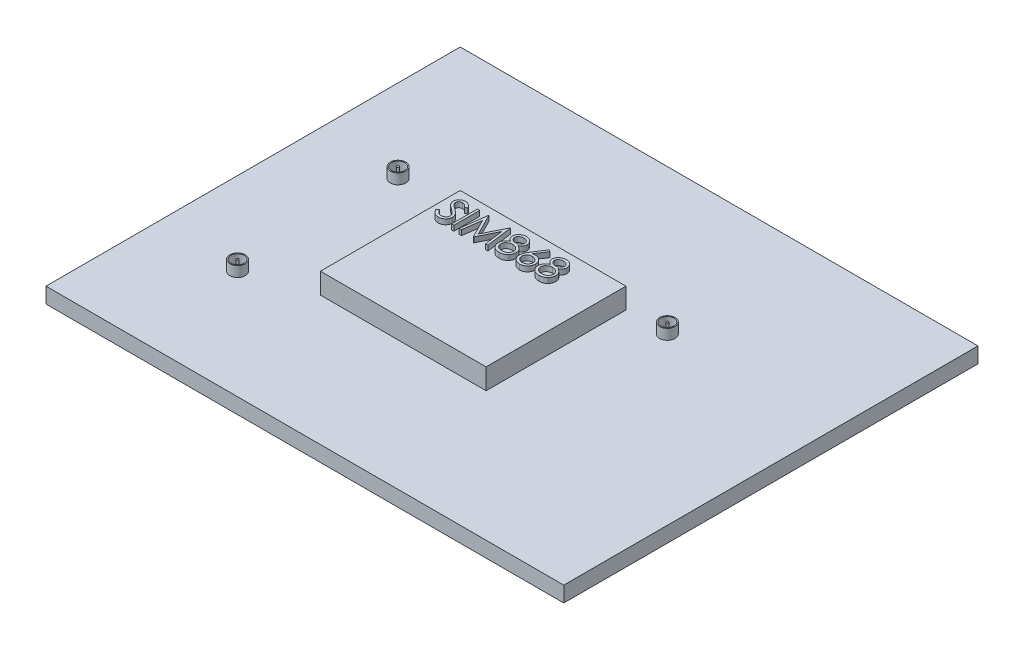
from build123d import *

# Parameters (mm, degrees)
SKETCH1_W           = 50
SKETCH1_H           = 40
BOSS_EXTRUDE1_DEPTH = 1.5
SKETCH2_W           = 16
SKETCH2_H           = 13.5
BOSS_EXTRUDE2_DEPTH = 2
SKETCH3_W           = 2.5
SKETCH3_H           = 2.5
BOSS_EXTRUDE3_DEPTH = 2
FILLET3_R           = 0.25
SKETCH4_R           = 0.25
BOSS_EXTRUDE4_DEPTH = 5.5
FILLET2_R           = 0.2
LPATTERN1_START     = -2
LPATTERN1_DEPTH     = 2
SKETCH5_W           = 0.224358974
SKETCH5_H           = 2.5
BOSS_EXTRUDE5_DEPTH = 0.5
SKETCH6_R           = 0.75
SKETCH6_R_2         = 0.65
SKETCH6_R_3         = 0.1
BOSS_EXTRUDE6_DEPTH = 1


# Read off the part's stored shape, not the designer's step: LPattern1
with BuildPart() as part:
    # Sketch1 → Boss-Extrude1 (new body)
    with BuildSketch(Plane(origin=(0, 0, 0), x_dir=(1, 0, 0), z_dir=(0, 1, 0))):
        with Locations((25, 20)):
            Rectangle(SKETCH1_W, SKETCH1_H)
    extrude(amount=BOSS_EXTRUDE1_DEPTH)

    # Sketch2 → Boss-Extrude2 (add)
    with BuildSketch(Plane(origin=(0, 1.5, 0), x_dir=(1, 0, 0), z_dir=(0, 1, 0))):
        with Locations((22, 19.25)):
            Rectangle(SKETCH2_W, SKETCH2_H)
    extrude(amount=BOSS_EXTRUDE2_DEPTH)

    # Sketch3 → Boss-Extrude3 (add)
    with BuildSketch(Plane(origin=(0, 0, 0), x_dir=(1, 0, 0), z_dir=(0, 1, 0))):
        with Locations((2.75, 26.25)):
            Rectangle(SKETCH3_W, SKETCH3_H)
    extrude(amount=-BOSS_EXTRUDE3_DEPTH)

    # Fillet3
    fillet3_edges = [part.edges().sort_by_distance(p)[0] for p in [
        (1.5, -1, -25),
        (1.5, -1, -27.5),
        (4, -1, -27.5),
        (4, -1, -25),
    ]]
    fillet(fillet3_edges, radius=FILLET3_R)

    # Sketch4 → Boss-Extrude4 (add)
    with BuildSketch(Plane(origin=(0, -2, 0), x_dir=(-1, 0, 0), z_dir=(0, -1, 0))):
        with Locations(Location((-2.75, 26.25, 0), (0, 0, 90))):
            Circle(SKETCH4_R)
    extrude(amount=BOSS_EXTRUDE4_DEPTH)

    # Fillet2
    fillet2_edges = [part.edges().sort_by_distance(p)[0] for p in [
        (2.75, -7.5, -26),
    ]]
    fillet(fillet2_edges, radius=FILLET2_R)

    # LPattern1 outline → LPattern1 (add)
    with BuildSketch(Plane(origin=(0, 0, 0), x_dir=(1, 0, 0), z_dir=(0, 1, 0)).offset(LPATTERN1_START)):
        with BuildLine():
            ThreePointArc((1.75, 25), (1.573223305, 24.926776695), (1.5, 24.75))
            Line((1.5, 24.75), (1.5, 22.75))
            ThreePointArc((1.5, 22.75), (1.573223305, 22.573223305), (1.75, 22.5))
            ThreePointArc((1.75, 22.5), (1.573223305, 22.426776695), (1.5, 22.25))
            Line((1.5, 22.25), (1.5, 20.25))
            ThreePointArc((1.5, 20.25), (1.573223305, 20.073223305), (1.75, 20))
            ThreePointArc((1.75, 20), (1.573223305, 19.926776695), (1.5, 19.75))
            Line((1.5, 19.75), (1.5, 17.75))
            ThreePointArc((1.5, 17.75), (1.573223305, 17.573223305), (1.75, 17.5))
            ThreePointArc((1.75, 17.5), (1.573223305, 17.426776695), (1.5, 17.25))
            Line((1.5, 17.25), (1.5, 15.25))
            ThreePointArc((1.5, 15.25), (1.573223305, 15.073223305), (1.75, 15))
            ThreePointArc((1.75, 15), (1.573223305, 14.926776695), (1.5, 14.75))
            Line((1.5, 14.75), (1.5, 12.75))
            ThreePointArc((1.5, 12.75), (1.573223305, 12.573223305), (1.75, 12.5))
            ThreePointArc((1.75, 12.5), (1.573223305, 12.426776695), (1.5, 12.25))
            Line((1.5, 12.25), (1.5, 10.25))
            ThreePointArc((1.5, 10.25), (1.573223305, 10.073223305), (1.75, 10))
            ThreePointArc((1.75, 10), (1.573223305, 9.926776695), (1.5, 9.75))
            Line((1.5, 9.75), (1.5, 7.75))
            ThreePointArc((1.5, 7.75), (1.573223305, 7.573223305), (1.75, 7.5))
            Line((1.75, 7.5), (3.75, 7.5))
            ThreePointArc((3.75, 7.5), (3.926776695, 7.573223305), (4, 7.75))
            Line((4, 7.75), (4, 9.75))
            ThreePointArc((4, 9.75), (3.926776695, 9.926776695), (3.75, 10))
            ThreePointArc((3.75, 10), (3.926776695, 10.073223305), (4, 10.25))
            Line((4, 10.25), (4, 12.25))
            ThreePointArc((4, 12.25), (3.926776695, 12.426776695), (3.75, 12.5))
            ThreePointArc((3.75, 12.5), (3.926776695, 12.573223305), (4, 12.75))
            Line((4, 12.75), (4, 14.75))
            ThreePointArc((4, 14.75), (3.926776695, 14.926776695), (3.75, 15))
            ThreePointArc((3.75, 15), (3.926776695, 15.073223305), (4, 15.25))
            Line((4, 15.25), (4, 17.25))
            ThreePointArc((4, 17.25), (3.926776695, 17.426776695), (3.75, 17.5))
            ThreePointArc((3.75, 17.5), (3.926776695, 17.573223305), (4, 17.75))
            Line((4, 17.75), (4, 19.75))
            ThreePointArc((4, 19.75), (3.926776695, 19.926776695), (3.75, 20))
            ThreePointArc((3.75, 20), (3.926776695, 20.073223305), (4, 20.25))
            Line((4, 20.25), (4, 22.25))
            ThreePointArc((4, 22.25), (3.926776695, 22.426776695), (3.75, 22.5))
            ThreePointArc((3.75, 22.5), (3.926776695, 22.573223305), (4, 22.75))
            Line((4, 22.75), (4, 24.75))
            ThreePointArc((4, 24.75), (3.926776695, 24.926776695), (3.75, 25))
            Line((3.75, 25), (1.75, 25))
        make_face()
    extrude(amount=LPATTERN1_DEPTH)

    # LPattern1 2 outline → LPattern1 2 (revolve)
    with BuildSketch(Plane(origin=(2.75, 0, -23.75), x_dir=(1, 0, 0), z_dir=(0, 0, 1))):
        with BuildLine():
            Line((0, -2), (0, -7.5))
            Line((0, -7.5), (0.05, -7.5))
            ThreePointArc((0.05, -7.5), (0.191421356, -7.441421356), (0.25, -7.3))
            Line((0.25, -7.3), (0.25, -2))
            Line((0.25, -2), (0, -2))
        make_face()
    revolve(axis=Axis((2.75, 0, -23.75), (0, 1, 0)))

    # LPattern1 3 outline → LPattern1 3 (revolve)
    with BuildSketch(Plane(origin=(2.75, 0, -21.25), x_dir=(1, 0, 0), z_dir=(0, 0, 1))):
        with BuildLine():
            Line((0, -2), (0, -7.5))
            Line((0, -7.5), (0.05, -7.5))
            ThreePointArc((0.05, -7.5), (0.191421356, -7.441421356), (0.25, -7.3))
            Line((0.25, -7.3), (0.25, -2))
            Line((0.25, -2), (0, -2))
        make_face()
    revolve(axis=Axis((2.75, 0, -21.25), (0, 1, 0)))

    # LPattern1 4 outline → LPattern1 4 (revolve)
    with BuildSketch(Plane(origin=(2.75, 0, -18.75), x_dir=(1, 0, 0), z_dir=(0, 0, 1))):
        with BuildLine():
            Line((0, -2), (0, -7.5))
            Line((0, -7.5), (0.05, -7.5))
            ThreePointArc((0.05, -7.5), (0.191421356, -7.441421356), (0.25, -7.3))
            Line((0.25, -7.3), (0.25, -2))
            Line((0.25, -2), (0, -2))
        make_face()
    revolve(axis=Axis((2.75, 0, -18.75), (0, 1, 0)))

    # LPattern1 5 outline → LPattern1 5 (revolve)
    with BuildSketch(Plane(origin=(2.75, 0, -16.25), x_dir=(1, 0, 0), z_dir=(0, 0, 1))):
        with BuildLine():
            Line((0, -2), (0, -7.5))
            Line((0, -7.5), (0.05, -7.5))
            ThreePointArc((0.05, -7.5), (0.191421356, -7.441421356), (0.25, -7.3))
            Line((0.25, -7.3), (0.25, -2))
            Line((0.25, -2), (0, -2))
        make_face()
    revolve(axis=Axis((2.75, 0, -16.25), (0, 1, 0)))

    # LPattern1 6 outline → LPattern1 6 (revolve)
    with BuildSketch(Plane(origin=(2.75, 0, -13.75), x_dir=(1, 0, 0), z_dir=(0, 0, 1))):
        with BuildLine():
            Line((0, -2), (0, -7.5))
            Line((0, -7.5), (0.05, -7.5))
            ThreePointArc((0.05, -7.5), (0.191421356, -7.441421356), (0.25, -7.3))
            Line((0.25, -7.3), (0.25, -2))
            Line((0.25, -2), (0, -2))
        make_face()
    revolve(axis=Axis((2.75, 0, -13.75), (0, 1, 0)))

    # LPattern1 7 outline → LPattern1 7 (revolve)
    with BuildSketch(Plane(origin=(2.75, 0, -11.25), x_dir=(1, 0, 0), z_dir=(0, 0, 1))):
        with BuildLine():
            Line((0, -2), (0, -7.5))
            Line((0, -7.5), (0.05, -7.5))
            ThreePointArc((0.05, -7.5), (0.191421356, -7.441421356), (0.25, -7.3))
            Line((0.25, -7.3), (0.25, -2))
            Line((0.25, -2), (0, -2))
        make_face()
    revolve(axis=Axis((2.75, 0, -11.25), (0, 1, 0)))

    # LPattern1 8 outline → LPattern1 8 (revolve)
    with BuildSketch(Plane(origin=(2.75, 0, -8.75), x_dir=(1, 0, 0), z_dir=(0, 0, 1))):
        with BuildLine():
            Line((0, -2), (0, -7.5))
            Line((0, -7.5), (0.05, -7.5))
            ThreePointArc((0.05, -7.5), (0.191421356, -7.441421356), (0.25, -7.3))
            Line((0.25, -7.3), (0.25, -2))
            Line((0.25, -2), (0, -2))
        make_face()
    revolve(axis=Axis((2.75, 0, -8.75), (0, 1, 0)))

    # Sketch5 → Boss-Extrude5 (add)
    # profile 1 of 6: a face of its own
    with BuildSketch(Plane(origin=(0, 3.5, 0), x_dir=(1, 0, 0), z_dir=(0, 1, 0))):
        with BuildLine():
            Line((14.892330451, 22.763294846), (15.103668592, 22.889997571))
            add(Edge.make_bspline(
                [(15.103668592, 22.889997571), (15.123324476, 22.857094439), (15.160984391, 22.794053307), (15.22380679, 22.708868993), (15.288901727, 22.636467452), (15.356751251, 22.577269875), (15.426941214, 22.530663528), (15.499929824, 22.497661934), (15.575471117, 22.477079094), (15.626880989, 22.474579032), (15.652546798, 22.473330904)],
                knots=[0, 0, 0, 0, 1.272034388, 2.437168799, 3.508375237, 4.49857839, 5.41946034, 6.295179144, 7.148887113, 8, 8, 8, 8], degree=3))
            add(Edge.make_bspline(
                [(15.652546798, 22.473330904), (15.674465984, 22.473941384), (15.717920821, 22.475151663), (15.781893852, 22.486780807), (15.844023711, 22.504646614), (15.903029881, 22.530232993), (15.958098177, 22.561189055), (16.006388673, 22.598579182), (16.048135897, 22.640440757), (16.082285265, 22.687142653), (16.10848529, 22.737369188), (16.128622482, 22.788923439), (16.139797534, 22.842615273), (16.14148093, 22.878765604), (16.142330451, 22.897008789)],
                knots=[0, 0, 0, 0, 1.095163259, 2.171163733, 3.241058638, 4.321873601, 5.38011039, 6.391990106, 7.366004449, 8.327778327, 9.272591725, 10.192022065, 11.087607919, 12, 12, 12, 12], degree=3))
            add(Edge.make_bspline(
                [(16.142330451, 22.897008789), (16.141277372, 22.917823681), (16.139136616, 22.960137316), (16.121042702, 23.02256564), (16.092578954, 23.084346047), (16.066319923, 23.122561237), (16.052687022, 23.142401417)],
                knots=[0, 0, 0, 0, 0.938893495, 1.908633276, 2.914225137, 4, 4, 4, 4], degree=3))
            add(Edge.make_bspline(
                [(16.052687022, 23.142401417), (16.041493726, 23.156720577), (16.017994802, 23.186781861), (15.977596578, 23.231528458), (15.930192211, 23.277684472), (15.877403957, 23.327012369), (15.817308894, 23.377217938), (15.751789241, 23.43069528), (15.679172199, 23.485410692), (15.628243987, 23.522105382), (15.601965868, 23.541039237)],
                knots=[0, 0, 0, 0, 0.722233717, 1.516239348, 2.393582979, 3.351407094, 4.387010283, 5.505090956, 6.712668013, 8, 8, 8, 8], degree=3))
            add(Edge.make_bspline(
                [(15.601965868, 23.541039237), (15.575663014, 23.559773943), (15.525373959, 23.595593273), (15.4550464, 23.648753476), (15.392157498, 23.69735624), (15.336986772, 23.741859106), (15.289558488, 23.782268109), (15.249498909, 23.818195208), (15.217828511, 23.850612038), (15.200217382, 23.871641567), (15.192310419, 23.881083308)],
                knots=[0, 0, 0, 0, 1.452282411, 2.77665338, 3.964542531, 5.026858415, 5.96415736, 6.766646006, 7.446254459, 8, 8, 8, 8], degree=3))
            add(Edge.make_bspline(
                [(15.192310419, 23.881083308), (15.181258601, 23.895798334), (15.159523718, 23.924737408), (15.130833714, 23.96996945), (15.106448598, 24.016271782), (15.087332646, 24.063768828), (15.071235347, 24.111793777), (15.060408254, 24.160973239), (15.053628684, 24.211086537), (15.052934408, 24.244810466), (15.052586862, 24.261692282)],
                knots=[0, 0, 0, 0, 1.068054152, 2.10047183, 3.106115577, 4.101338837, 5.06977816, 6.043150881, 7.020423561, 8, 8, 8, 8], degree=3))
            add(Edge.make_bspline(
                [(15.052586862, 24.261692282), (15.053519154, 24.288142121), (15.055363811, 24.340476452), (15.07096418, 24.416927046), (15.095587676, 24.489917344), (15.130084024, 24.558724725), (15.174553562, 24.621557568), (15.226014972, 24.67913863), (15.287308891, 24.727544761), (15.354560765, 24.769839088), (15.428172459, 24.80294332), (15.505308819, 24.827915449), (15.586092442, 24.842064919), (15.640808966, 24.844095465), (15.668572439, 24.845125776)],
                knots=[0, 0, 0, 0, 1.005424448, 1.989358655, 2.955360095, 3.929531133, 4.905563448, 5.876582895, 6.856512386, 7.866279853, 8.892233794, 9.918561126, 10.94386622, 12, 12, 12, 12], degree=3))
            add(Edge.make_bspline(
                [(15.668572439, 24.845125776), (15.69803251, 24.844109668), (15.75661919, 24.842088952), (15.842797201, 24.824519287), (15.925769141, 24.795447379), (15.992514331, 24.76245548), (16.044752017, 24.729504469), (16.084589684, 24.699490309), (16.124959291, 24.66493666), (16.166186473, 24.625751484), (16.207572659, 24.581575233), (16.249732267, 24.532710455), (16.292763888, 24.479455773), (16.320446645, 24.441438272), (16.334638144, 24.421948692)],
                knots=[0, 0, 0, 0, 1.286793592, 2.559021753, 3.825965368, 5.121522368, 5.803751409, 6.523245864, 7.299691795, 8.125521123, 9.008227632, 9.944561021, 10.946284179, 12, 12, 12, 12], degree=3))
            Line((16.334638144, 24.421948692), (16.131813624, 24.268202699))
            add(Edge.make_bspline(
                [(16.131813624, 24.268202699), (16.11956653, 24.283980335), (16.095981489, 24.314364373), (16.060174713, 24.356915313), (16.026425678, 24.395784227), (15.993175393, 24.429545032), (15.962179942, 24.460046556), (15.93209634, 24.486160668), (15.903357518, 24.508143236), (15.867131153, 24.531602922), (15.821618497, 24.554857567), (15.764486686, 24.57453548), (15.704782204, 24.586360525), (15.664118181, 24.587924016), (15.643532374, 24.588715519)],
                knots=[0, 0, 0, 0, 1.181633172, 2.275549214, 3.290209073, 4.226197932, 5.078386478, 5.862611352, 6.581680152, 7.217281963, 8.414376989, 9.595101626, 10.782541182, 12, 12, 12, 12], degree=3))
            add(Edge.make_bspline(
                [(15.643532374, 24.588715519), (15.617706287, 24.587850019), (15.56790311, 24.586180984), (15.497195799, 24.567952423), (15.433557281, 24.539251095), (15.378876877, 24.49902611), (15.333350465, 24.451368258), (15.300417995, 24.396526219), (15.280596448, 24.33596736), (15.278177677, 24.29372332), (15.276945836, 24.272209109)],
                knots=[0, 0, 0, 0, 1.14458467, 2.207223713, 3.21896685, 4.227309161, 5.202851033, 6.127160689, 7.046193047, 8, 8, 8, 8], degree=3))
            add(Edge.make_bspline(
                [(15.276945836, 24.272209109), (15.277226641, 24.258815196), (15.277788709, 24.232005468), (15.285627851, 24.192397309), (15.2956988, 24.15288921), (15.311657823, 24.113658793), (15.333690182, 24.074019965), (15.362622451, 24.033290153), (15.399060531, 23.991110361), (15.426972682, 23.963676523), (15.441709458, 23.949192282)],
                knots=[0, 0, 0, 0, 0.858281714, 1.717966888, 2.583508476, 3.4729293, 4.427298488, 5.488583878, 6.674047936, 8, 8, 8, 8], degree=3))
            add(Edge.make_bspline(
                [(15.441709458, 23.949192282), (15.447181867, 23.944308692), (15.460183057, 23.932706401), (15.483951576, 23.913711915), (15.515339289, 23.890281363), (15.553526575, 23.861290423), (15.599217548, 23.827660807), (15.652417231, 23.789822512), (15.712532612, 23.746547184), (15.755191123, 23.716291798), (15.777747118, 23.700294045)],
                knots=[0, 0, 0, 0, 0.420754252, 0.999615792, 1.744751191, 2.668019286, 3.750313428, 4.999500688, 6.413464383, 8, 8, 8, 8], degree=3))
            add(Edge.make_bspline(
                [(15.777747118, 23.700294045), (15.804879913, 23.680550217), (15.857418811, 23.64231903), (15.932174225, 23.584879258), (15.999955516, 23.528702281), (16.061000662, 23.474146847), (16.115912739, 23.421626781), (16.16408254, 23.370510223), (16.206000883, 23.321163386), (16.251128896, 23.25789726), (16.297241624, 23.180196486), (16.336842701, 23.084997744), (16.361812949, 22.989428944), (16.365078317, 22.925195489), (16.366689426, 22.89350318)],
                knots=[0, 0, 0, 0, 1.163667725, 2.253281268, 3.268753668, 4.215851969, 5.092017293, 5.902905408, 6.650798638, 7.335211899, 8.59617414, 9.77448103, 10.901945474, 12, 12, 12, 12], degree=3))
            add(Edge.make_bspline(
                [(16.366689426, 22.89350318), (16.366220041, 22.871090062), (16.365290388, 22.826699074), (16.354604021, 22.761516876), (16.338947117, 22.698209112), (16.315349093, 22.637558317), (16.286546837, 22.578454915), (16.249999517, 22.522449272), (16.207636885, 22.468301844), (16.159041339, 22.417456493), (16.105865694, 22.370780639), (16.049663055, 22.329259881), (15.990341432, 22.29463965), (15.928222634, 22.266389049), (15.863292393, 22.244293679), (15.795572548, 22.228284487), (15.724951468, 22.218458979), (15.676951124, 22.217439149), (15.652546798, 22.216920648)],
                knots=[0, 0, 0, 0, 0.983748083, 1.948392443, 2.894712957, 3.844097841, 4.80183111, 5.778335162, 6.776009319, 7.81870978, 8.863265674, 9.881300176, 10.883814829, 11.87499822, 12.874611388, 13.892143829, 14.928324115, 16, 16, 16, 16], degree=3))
            add(Edge.make_bspline(
                [(15.652546798, 22.216920648), (15.63366441, 22.217285777), (15.596137438, 22.218011438), (15.540630665, 22.224426639), (15.486245245, 22.233503141), (15.433663615, 22.247913191), (15.382208321, 22.265396746), (15.332103153, 22.286924127), (15.283323829, 22.312722128), (15.235596984, 22.342218574), (15.189044002, 22.376545534), (15.144101525, 22.416526603), (15.099294964, 22.461059107), (15.055946824, 22.511352366), (15.013180292, 22.566593854), (14.971838571, 22.627300414), (14.931065915, 22.693141381), (14.905483438, 22.739473585), (14.892330451, 22.763294846)],
                knots=[0, 0, 0, 0, 0.915332311, 1.819136955, 2.706846663, 3.586547465, 4.459518054, 5.340707479, 6.227863349, 7.133153174, 8.059268498, 9.028702269, 10.047606654, 11.120612155, 12.245963614, 13.433783089, 14.680604001, 16, 16, 16, 16], degree=3))
        make_face()
    # profile 2 of 6: a face of its own
    with BuildSketch(Plane(origin=(0, 3.5, 0), x_dir=(1, 0, 0), z_dir=(0, 1, 0))):
        with Locations((16.991689426, 23.531023212)):
            Rectangle(SKETCH5_W, SKETCH5_H)
    # profile 3 of 6: a face of its own
    with BuildSketch(Plane(origin=(0, 3.5, 0), x_dir=(1, 0, 0), z_dir=(0, 1, 0))):
        Polygon((17.616689426, 22.281023212), (17.946717471, 24.781023212), (17.978768753, 24.781023212), (19.010920195, 22.72974116), (20.040567631, 24.781023212), (20.073119714, 24.781023212), (20.405150964, 22.281023212), (20.179790387, 22.281023212), (19.940407374, 24.079901417), (19.037963464, 22.281023212), (18.987382535, 22.281023212), (18.081433015, 24.083907827), (17.842550804, 22.281023212), align=None)
    # profile 4 of 6: a face of its own
    with BuildSketch(Plane(origin=(0, 3.5, 0), x_dir=(1, 0, 0), z_dir=(0, 1, 0))):
        with BuildLine():
            add(Edge.make_bspline(
                [(21.909057214, 23.673751577), (21.929520462, 23.663081609), (21.96943063, 23.642271606), (22.026271493, 23.608763872), (22.078217922, 23.573448898), (22.126711181, 23.537994712), (22.170899288, 23.501043533), (22.210288155, 23.462448421), (22.24585074, 23.423172746), (22.276869872, 23.382551431), (22.304153327, 23.340692396), (22.327733423, 23.297485773), (22.347888568, 23.253026249), (22.363862096, 23.206828513), (22.377020518, 23.159571183), (22.386074522, 23.110644053), (22.390943749, 23.060369524), (22.39186433, 23.026392166), (22.392330451, 23.009188276)],
                knots=[0, 0, 0, 0, 1.272397273, 2.481599622, 3.635517121, 4.734568067, 5.792894095, 6.808321871, 7.773003508, 8.711915296, 9.623354172, 10.525449501, 11.423591555, 12.311487226, 13.218079475, 14.126165749, 15.051214107, 16, 16, 16, 16], degree=3))
            add(Edge.make_bspline(
                [(22.392330451, 23.009188276), (22.391779437, 22.985118467), (22.390688772, 22.937475283), (22.381188783, 22.867156632), (22.366965227, 22.798862502), (22.346194147, 22.732607866), (22.319256011, 22.668758314), (22.286058271, 22.60725919), (22.248478838, 22.54710254), (22.218298668, 22.510088682), (22.203027567, 22.49135975)],
                knots=[0, 0, 0, 0, 1.025265484, 2.029385089, 3.018602448, 3.995076438, 4.983346944, 5.966715145, 6.97116228, 8, 8, 8, 8], degree=3))
            add(Edge.make_bspline(
                [(22.203027567, 22.49135975), (22.183144371, 22.469507054), (22.143623681, 22.426071702), (22.07592159, 22.369678267), (22.001620244, 22.322285842), (21.92100715, 22.283663061), (21.834297791, 22.253601733), (21.741510645, 22.231999934), (21.642464822, 22.219626771), (21.574389485, 22.217838206), (21.539465868, 22.216920648)],
                knots=[0, 0, 0, 0, 0.954267603, 1.896743057, 2.838368354, 3.796610408, 4.779680527, 5.799409237, 6.871065594, 8, 8, 8, 8], degree=3))
            add(Edge.make_bspline(
                [(21.539465868, 22.216920648), (21.505884876, 22.217743846), (21.440539677, 22.219345707), (21.345426907, 22.230198872), (21.256767572, 22.249218777), (21.174046166, 22.275250641), (21.097761385, 22.30911509), (21.028130598, 22.351263953), (20.964149189, 22.400000697), (20.907758851, 22.456725039), (20.857695677, 22.517480662), (20.813718496, 22.580160383), (20.777165583, 22.644769924), (20.746217658, 22.710345901), (20.722526213, 22.77780744), (20.706117491, 22.846807449), (20.695696553, 22.917225408), (20.694310028, 22.964748018), (20.693612503, 22.988655423)],
                knots=[0, 0, 0, 0, 1.256902934, 2.445805442, 3.576955095, 4.645999104, 5.686449165, 6.692658513, 7.68621702, 8.689161843, 9.678783111, 10.630372946, 11.551080876, 12.453998257, 13.34127905, 14.221779781, 15.105423033, 16, 16, 16, 16], degree=3))
            add(Edge.make_bspline(
                [(20.693612503, 22.988655423), (20.694025275, 23.006197703), (20.694841058, 23.04086744), (20.700487378, 23.092088389), (20.709564851, 23.141942771), (20.721893034, 23.190614731), (20.73860091, 23.237749926), (20.758773863, 23.283571692), (20.782296686, 23.328131763), (20.809497518, 23.371673821), (20.841141821, 23.413587758), (20.876972999, 23.454584897), (20.917707191, 23.494029088), (20.962891233, 23.532402249), (21.012008761, 23.570385087), (21.066335569, 23.605924893), (21.124431474, 23.641537725), (21.16572105, 23.662829386), (21.186901765, 23.673751577)],
                knots=[0, 0, 0, 0, 0.941657376, 1.861047343, 2.762797495, 3.66048619, 4.553285746, 5.444104102, 6.34607688, 7.256116206, 8.197091036, 9.162375105, 10.176350973, 11.237807142, 12.343728897, 13.50695164, 14.721116704, 16, 16, 16, 16], degree=3))
            add(Edge.make_bspline(
                [(21.186901765, 23.673751577), (21.157907926, 23.689562126), (21.101767739, 23.720175774), (21.027432424, 23.776423493), (20.963581978, 23.837343361), (20.911971466, 23.904221786), (20.871348446, 23.974969553), (20.843478014, 24.049144019), (20.824623382, 24.125369814), (20.822755649, 24.177445669), (20.821817631, 24.203599334)],
                knots=[0, 0, 0, 0, 1.166880483, 2.259407225, 3.286803203, 4.280235371, 5.237608625, 6.161067461, 7.076446754, 8, 8, 8, 8], degree=3))
            add(Edge.make_bspline(
                [(20.821817631, 24.203599334), (20.822985791, 24.230240447), (20.825333996, 24.28379373), (20.844322083, 24.36351239), (20.875264987, 24.441809936), (20.917351414, 24.518306874), (20.969770854, 24.59041417), (21.032661244, 24.655086275), (21.104520741, 24.711737333), (21.184990646, 24.759291743), (21.271587958, 24.797994356), (21.362956332, 24.824693229), (21.457503827, 24.842147598), (21.521859341, 24.84412378), (21.554489906, 24.845125776)],
                knots=[0, 0, 0, 0, 0.888701115, 1.786444228, 2.72001202, 3.692817113, 4.693886446, 5.687152267, 6.695133018, 7.739871481, 8.800368666, 9.853104506, 10.91144658, 12, 12, 12, 12], degree=3))
            add(Edge.make_bspline(
                [(21.554489906, 24.845125776), (21.586278346, 24.844092674), (21.648961527, 24.842055514), (21.741100546, 24.825064887), (21.829261173, 24.796686658), (21.913139387, 24.758188641), (21.991233578, 24.710769398), (22.060235227, 24.653340202), (22.121187071, 24.58895338), (22.171604496, 24.516867949), (22.213149417, 24.440664954), (22.242078632, 24.360934582), (22.260615756, 24.27939954), (22.262953873, 24.224229537), (22.264125323, 24.196588116)],
                knots=[0, 0, 0, 0, 1.072916533, 2.115669174, 3.151510826, 4.193348718, 5.225979165, 6.227137561, 7.216255879, 8.211077061, 9.189680878, 10.138522389, 11.067357538, 12, 12, 12, 12], degree=3))
            add(Edge.make_bspline(
                [(22.264125323, 24.196588116), (22.263100637, 24.169461927), (22.261088212, 24.116187635), (22.244159683, 24.038525834), (22.215650174, 23.965795807), (22.176725772, 23.897172269), (22.12599328, 23.833899771), (22.0641299, 23.775173721), (21.991628844, 23.720511701), (21.937156782, 23.689664298), (21.909057214, 23.673751577)],
                knots=[0, 0, 0, 0, 0.975232327, 1.915300861, 2.843280834, 3.77672583, 4.742871857, 5.749627742, 6.839139064, 8, 8, 8, 8], degree=3))
        make_face()
        with BuildLine():
            add(Edge.make_bspline(
                [(21.541969874, 24.588715519), (21.524433585, 24.588250205), (21.490124934, 24.587339846), (21.43981874, 24.582583676), (21.391981335, 24.573331379), (21.346112906, 24.561018013), (21.302842326, 24.544383736), (21.26158193, 24.524815872), (21.223033937, 24.501025826), (21.186733006, 24.474339256), (21.154053881, 24.44498718), (21.12505063, 24.414405952), (21.10095912, 24.381994958), (21.080501185, 24.348560415), (21.065657244, 24.313110004), (21.054539884, 24.276730592), (21.047024604, 24.23896246), (21.046461468, 24.213150667), (21.046176605, 24.200093725)],
                knots=[0, 0, 0, 0, 1.203892937, 2.355340988, 3.463153438, 4.544400666, 5.610487187, 6.640501085, 7.674077295, 8.714426146, 9.728707835, 10.68524104, 11.601827946, 12.495867327, 13.368432065, 14.231010473, 15.105153427, 16, 16, 16, 16], degree=3))
            add(Edge.make_bspline(
                [(21.046176605, 24.200093725), (21.046667582, 24.187036218), (21.047637821, 24.161232708), (21.055141484, 24.123128518), (21.066324952, 24.085684492), (21.083932567, 24.049790984), (21.105051395, 24.014202871), (21.131116735, 23.979809595), (21.162180326, 23.946491463), (21.197199926, 23.914531862), (21.235351025, 23.884604174), (21.275768198, 23.85862333), (21.317944192, 23.83688468), (21.36144567, 23.818792248), (21.40671599, 23.804728007), (21.453477757, 23.794750402), (21.50173883, 23.788548976), (21.534439245, 23.787808247), (21.550984298, 23.787433468)],
                knots=[0, 0, 0, 0, 0.873023192, 1.725219244, 2.590779336, 3.480155217, 4.391973325, 5.357036234, 6.360879153, 7.436073238, 8.526419356, 9.601555421, 10.645666583, 11.697338044, 12.750135903, 13.812665442, 14.89329948, 16, 16, 16, 16], degree=3))
            add(Edge.make_bspline(
                [(21.550984298, 23.787433468), (21.572234372, 23.788056945), (21.614524634, 23.78929774), (21.676867014, 23.800834292), (21.737483189, 23.818981376), (21.795725263, 23.843809924), (21.850085681, 23.874972681), (21.898542873, 23.912281979), (21.94068351, 23.954876335), (21.976069661, 24.002092646), (22.003505265, 24.05234378), (22.024863699, 24.102772561), (22.037335996, 24.153917012), (22.03896283, 24.188179129), (22.039766349, 24.205101737)],
                knots=[0, 0, 0, 0, 1.076279235, 2.141928126, 3.20205304, 4.278698113, 5.344010996, 6.36967002, 7.368914609, 8.37248503, 9.349703398, 10.264243087, 11.142681841, 12, 12, 12, 12], degree=3))
            add(Edge.make_bspline(
                [(22.039766349, 24.205101737), (22.039386422, 24.216978906), (22.038632322, 24.240553383), (22.032417996, 24.275366501), (22.022149544, 24.309387632), (22.008247344, 24.342897826), (21.989954633, 24.37542692), (21.968265928, 24.407486268), (21.941919855, 24.438354671), (21.912350974, 24.468751492), (21.87881854, 24.496882937), (21.841387174, 24.521622016), (21.800248781, 24.542630842), (21.755402388, 24.559694238), (21.707013156, 24.572510202), (21.65530396, 24.582107593), (21.599843641, 24.587516959), (21.561679533, 24.588307334), (21.541969874, 24.588715519)],
                knots=[0, 0, 0, 0, 0.814439003, 1.616544685, 2.417341072, 3.248991801, 4.09997495, 4.973547432, 5.9003056, 6.880240646, 7.880314356, 8.896779544, 9.951930927, 11.043077905, 12.18215768, 13.381699519, 14.647792085, 16, 16, 16, 16], degree=3))
        make_face(mode=Mode.SUBTRACT)
        with BuildLine():
            add(Edge.make_bspline(
                [(21.556493112, 23.531023212), (21.534260408, 23.530627754), (21.490645267, 23.529851961), (21.426747461, 23.521216604), (21.365423772, 23.509195609), (21.30688096, 23.490959296), (21.251143748, 23.467247517), (21.197910403, 23.438722845), (21.147588168, 23.405004672), (21.100871935, 23.366521375), (21.058212414, 23.325050336), (21.020785057, 23.281148811), (20.989001114, 23.235632716), (20.963405934, 23.187923981), (20.942397554, 23.139032831), (20.928601928, 23.087741691), (20.919757848, 23.03503661), (20.918570254, 22.999207969), (20.917971477, 22.981143404)],
                knots=[0, 0, 0, 0, 1.140299081, 2.23698856, 3.303958914, 4.344563908, 5.37730929, 6.408454204, 7.439741482, 8.480804886, 9.510774543, 10.48932336, 11.43758569, 12.353841022, 13.263987381, 14.161954604, 15.073269652, 16, 16, 16, 16], degree=3))
            add(Edge.make_bspline(
                [(20.917971477, 22.981143404), (20.918945233, 22.958692757), (20.920877143, 22.914151197), (20.936203314, 22.848320432), (20.960800125, 22.784591107), (20.99510385, 22.72348257), (21.037580688, 22.666375351), (21.089813879, 22.616597654), (21.148557335, 22.572368026), (21.215798659, 22.536596217), (21.289247563, 22.508028463), (21.368884513, 22.488345633), (21.453566597, 22.475316026), (21.512037735, 22.474003039), (21.541969874, 22.473330904)],
                knots=[0, 0, 0, 0, 0.898778495, 1.783155532, 2.693654817, 3.627872908, 4.583023416, 5.533784346, 6.509005473, 7.520592997, 8.575161974, 9.658835044, 10.801527049, 12, 12, 12, 12], degree=3))
            add(Edge.make_bspline(
                [(21.541969874, 22.473330904), (21.565362994, 22.473780053), (21.610940294, 22.474655139), (21.677430257, 22.482379635), (21.740176363, 22.494629367), (21.799056934, 22.512446185), (21.854731105, 22.534196168), (21.906254929, 22.562176227), (21.954953877, 22.593999315), (21.99842825, 22.631755141), (22.0380234, 22.672097637), (22.07254718, 22.714804811), (22.102516859, 22.758715977), (22.126038971, 22.804823466), (22.144843438, 22.85224269), (22.158360262, 22.901410913), (22.166700416, 22.952478936), (22.167543913, 22.98712113), (22.167971477, 23.004681064)],
                knots=[0, 0, 0, 0, 1.224942928, 2.386581632, 3.501229538, 4.569074225, 5.605009692, 6.626002462, 7.634866581, 8.645888296, 9.63523824, 10.59253846, 11.518950513, 12.414518923, 13.29783783, 14.186679152, 15.080837789, 16, 16, 16, 16], degree=3))
            add(Edge.make_bspline(
                [(22.167971477, 23.004681064), (22.167324442, 23.021736308), (22.166048603, 23.055366268), (22.157950966, 23.105199501), (22.14372534, 23.153344369), (22.124205771, 23.200380087), (22.098219369, 23.245353623), (22.06761589, 23.289436603), (22.03069152, 23.331405492), (21.988968237, 23.371586275), (21.94349755, 23.408740372), (21.895163876, 23.441607829), (21.84433926, 23.469287912), (21.791131252, 23.491799694), (21.735657998, 23.50950503), (21.677960299, 23.521873597), (21.617970603, 23.529659028), (21.577217123, 23.530563347), (21.556493112, 23.531023212)],
                knots=[0, 0, 0, 0, 0.917430815, 1.809013306, 2.70690318, 3.612392954, 4.541220862, 5.495268465, 6.494511384, 7.542276156, 8.608045339, 9.649016899, 10.681629292, 11.715607085, 12.752076957, 13.808767841, 14.885711793, 16, 16, 16, 16], degree=3))
        make_face(mode=Mode.SUBTRACT)
    # profile 5 of 6: a face of its own
    with BuildSketch(Plane(origin=(0, 3.5, 0), x_dir=(1, 0, 0), z_dir=(0, 1, 0))):
        with BuildLine():
            Line((23.77053558, 24.845125776), (23.943312022, 24.709408628))
            Line((23.943312022, 24.709408628), (23.282755131, 23.699292442))
            add(Edge.make_bspline(
                [(23.282755131, 23.699292442), (23.3267339, 23.706302343), (23.412519462, 23.719975946), (23.499352247, 23.722231622), (23.541669394, 23.723330904)],
                knots=[0, 0, 0, 0, 1.025318673, 2, 2, 2, 2], degree=3))
            add(Edge.make_bspline(
                [(23.541669394, 23.723330904), (23.56707832, 23.722647967), (23.617095034, 23.721303626), (23.690528464, 23.710958018), (23.76109199, 23.694654367), (23.828493142, 23.67088847), (23.892973843, 23.640529645), (23.954904126, 23.604144738), (24.013119847, 23.559854966), (24.06837069, 23.510379998), (24.118532902, 23.455582152), (24.16294437, 23.39743834), (24.200249222, 23.336009139), (24.230516309, 23.271325664), (24.254019793, 23.203487621), (24.271153825, 23.132581807), (24.281282106, 23.058559328), (24.282657456, 23.008217774), (24.283356092, 22.982645808)],
                knots=[0, 0, 0, 0, 1.04369286, 2.054478336, 3.041073146, 4.015093852, 4.984733326, 5.965804835, 6.960378782, 7.985147595, 9.009457201, 10.008161701, 10.986880575, 11.956520048, 12.937015923, 13.931873656, 14.949455224, 16, 16, 16, 16], degree=3))
            add(Edge.make_bspline(
                [(24.283356092, 22.982645808), (24.282339589, 22.947660305), (24.280339351, 22.878817115), (24.260408068, 22.778548039), (24.229436893, 22.683024814), (24.18516723, 22.593772548), (24.130179813, 22.51091357), (24.06312439, 22.437495381), (23.986379041, 22.372016783), (23.899602757, 22.317262054), (23.806214925, 22.272545589), (23.708106356, 22.240427559), (23.606229823, 22.220653653), (23.537083674, 22.218174651), (23.502106092, 22.216920648)],
                knots=[0, 0, 0, 0, 1.031375318, 2.029502543, 3.004789286, 3.987476834, 4.960371455, 5.9300674, 6.912260825, 7.929083631, 8.949397511, 9.960523116, 10.96833055, 12, 12, 12, 12], degree=3))
            add(Edge.make_bspline(
                [(23.502106092, 22.216920648), (23.468465592, 22.218012223), (23.40182965, 22.220174443), (23.303806226, 22.239435827), (23.209618356, 22.270655186), (23.119925942, 22.313665385), (23.036839789, 22.367992445), (22.962507192, 22.433394073), (22.897298782, 22.508472262), (22.843031195, 22.593215367), (22.799989244, 22.684279623), (22.767710726, 22.779234734), (22.748856266, 22.877734721), (22.746221583, 22.944506963), (22.744894554, 22.978138596)],
                knots=[0, 0, 0, 0, 1.012016664, 2.004627821, 2.994792927, 3.992885782, 4.990978636, 5.973936114, 6.964471063, 7.975201453, 8.993600317, 9.990122807, 10.98767138, 12, 12, 12, 12], degree=3))
            add(Edge.make_bspline(
                [(22.744894554, 22.978138596), (22.745738443, 23.003884727), (22.747461504, 23.056453407), (22.759492497, 23.13607057), (22.778824493, 23.217535628), (22.800474669, 23.286645767), (22.823350105, 23.34326114), (22.842387633, 23.38890649), (22.866083345, 23.435878685), (22.891350046, 23.485788425), (22.920462095, 23.537349448), (22.95211613, 23.591423498), (22.987187309, 23.647150589), (23.01177314, 23.684967872), (23.024341669, 23.704300455)],
                knots=[0, 0, 0, 0, 1.173818275, 2.396712641, 3.66331629, 4.989737886, 5.693666774, 6.447286557, 7.243889047, 8.091586357, 8.998013824, 9.943181721, 10.948533338, 12, 12, 12, 12], degree=3))
            Line((23.024341669, 23.704300455), (23.77053558, 24.845125776))
        make_face()
        with BuildLine():
            add(Edge.make_bspline(
                [(23.494594073, 23.466920648), (23.475549613, 23.466364902), (23.438350249, 23.46527937), (23.383773524, 23.458975618), (23.332121201, 23.447104857), (23.282708963, 23.431986049), (23.236460604, 23.411198149), (23.193040004, 23.385946864), (23.152279253, 23.356217451), (23.114605287, 23.322431086), (23.080448385, 23.285439634), (23.051033291, 23.245818547), (23.025660148, 23.204522687), (23.005030278, 23.161207014), (22.988965938, 23.115888086), (22.977345759, 23.068774336), (22.970878794, 23.019549832), (22.969802914, 22.986169473), (22.969253528, 22.969124173)],
                knots=[0, 0, 0, 0, 1.129588631, 2.206414736, 3.251139165, 4.268635594, 5.265702196, 6.250456724, 7.242448911, 8.251968645, 9.246821453, 10.222880186, 11.173611482, 12.116736599, 13.062300278, 14.020270554, 14.989073742, 16, 16, 16, 16], degree=3))
            add(Edge.make_bspline(
                [(22.969253528, 22.969124173), (22.969700929, 22.95223133), (22.970578216, 22.919106981), (22.978544159, 22.870293281), (22.990712075, 22.823318346), (23.008812358, 22.778424347), (23.030402992, 22.734926977), (23.058906795, 22.694401773), (23.090490214, 22.654387438), (23.128243023, 22.617957815), (23.168759711, 22.584060226), (23.212046284, 22.554431474), (23.257160541, 22.529084207), (23.304711557, 22.509219137), (23.354024688, 22.492916075), (23.405510798, 22.48144359), (23.459205695, 22.4749575), (23.495578508, 22.473880219), (23.514125323, 22.473330904)],
                knots=[0, 0, 0, 0, 0.989467248, 1.94019797, 2.891935182, 3.827694429, 4.772920941, 5.730924762, 6.725747692, 7.756678648, 8.79901574, 9.819492441, 10.826891316, 11.826466727, 12.835195252, 13.867842842, 14.912794438, 16, 16, 16, 16], degree=3))
            add(Edge.make_bspline(
                [(23.514125323, 22.473330904), (23.532672108, 22.473880262), (23.569044861, 22.474957628), (23.62274019, 22.481443106), (23.674224703, 22.492917854), (23.723543638, 22.50921269), (23.771073231, 22.529108125), (23.816148033, 22.554273782), (23.859025242, 22.584242438), (23.899568528, 22.617899887), (23.937164198, 22.654594781), (23.969505111, 22.694044583), (23.997135992, 22.735254508), (24.019588983, 22.778253001), (24.037489905, 22.823345492), (24.049719525, 22.870286009), (24.057669017, 22.919108885), (24.058548564, 22.952231974), (24.058997118, 22.969124173)],
                knots=[0, 0, 0, 0, 1.087397944, 2.132534446, 3.165364764, 4.174271784, 5.174024072, 6.181601208, 7.194203697, 8.236725232, 9.267838612, 10.269026844, 11.221737037, 12.171628256, 13.107553087, 14.05945871, 15.010357665, 16, 16, 16, 16], degree=3))
            add(Edge.make_bspline(
                [(24.058997118, 22.969124173), (24.058604052, 22.98619171), (24.05783259, 23.019689733), (24.049106912, 23.068752317), (24.037005217, 23.116127465), (24.018731624, 23.161517428), (23.994991234, 23.204743091), (23.966074515, 23.246022805), (23.932622679, 23.285673054), (23.893981579, 23.322503631), (23.851917127, 23.356180115), (23.807191709, 23.38590837), (23.760400299, 23.410997639), (23.71159034, 23.431931283), (23.660202567, 23.447038051), (23.60706661, 23.458933224), (23.551502865, 23.465263237), (23.513805288, 23.46636114), (23.494594073, 23.466920648)],
                knots=[0, 0, 0, 0, 0.978206639, 1.919901502, 2.851605144, 3.780102724, 4.718870031, 5.675451981, 6.667674623, 7.690630536, 8.733308323, 9.756129687, 10.767539656, 11.776269907, 12.797430371, 13.836405707, 14.897401972, 16, 16, 16, 16], degree=3))
        make_face(mode=Mode.SUBTRACT)
    # profile 6 of 6: a face of its own
    with BuildSketch(Plane(origin=(0, 3.5, 0), x_dir=(1, 0, 0), z_dir=(0, 1, 0))):
        with BuildLine():
            add(Edge.make_bspline(
                [(25.75521106, 23.673751577), (25.775674308, 23.663081609), (25.815584476, 23.642271606), (25.872425339, 23.608763872), (25.924371768, 23.573448898), (25.972865027, 23.537994712), (26.017053134, 23.501043533), (26.056442001, 23.462448421), (26.092004586, 23.423172746), (26.123023718, 23.382551431), (26.150307173, 23.340692396), (26.173887269, 23.297485773), (26.194042414, 23.253026249), (26.210015942, 23.206828513), (26.223174364, 23.159571183), (26.232228368, 23.110644053), (26.237097595, 23.060369524), (26.238018176, 23.026392166), (26.238484298, 23.009188276)],
                knots=[0, 0, 0, 0, 1.272397273, 2.481599622, 3.635517121, 4.734568067, 5.792894095, 6.808321871, 7.773003508, 8.711915296, 9.623354172, 10.525449501, 11.423591555, 12.311487226, 13.218079475, 14.126165749, 15.051214107, 16, 16, 16, 16], degree=3))
            add(Edge.make_bspline(
                [(26.238484298, 23.009188276), (26.237933283, 22.985118467), (26.236842618, 22.937475283), (26.227342629, 22.867156632), (26.213119073, 22.798862502), (26.192347993, 22.732607866), (26.165409857, 22.668758314), (26.132212117, 22.60725919), (26.094632685, 22.54710254), (26.064452514, 22.510088682), (26.049181413, 22.49135975)],
                knots=[0, 0, 0, 0, 1.025265484, 2.029385089, 3.018602448, 3.995076438, 4.983346944, 5.966715145, 6.97116228, 8, 8, 8, 8], degree=3))
            add(Edge.make_bspline(
                [(26.049181413, 22.49135975), (26.029298217, 22.469507054), (25.989777527, 22.426071702), (25.922075436, 22.369678267), (25.847774091, 22.322285842), (25.767160996, 22.283663061), (25.680451638, 22.253601733), (25.587664491, 22.231999934), (25.488618668, 22.219626771), (25.420543331, 22.217838206), (25.385619714, 22.216920648)],
                knots=[0, 0, 0, 0, 0.954267603, 1.896743057, 2.838368354, 3.796610408, 4.779680527, 5.799409237, 6.871065594, 8, 8, 8, 8], degree=3))
            add(Edge.make_bspline(
                [(25.385619714, 22.216920648), (25.352038722, 22.217743846), (25.286693523, 22.219345707), (25.191580753, 22.230198872), (25.102921418, 22.249218777), (25.020200012, 22.275250641), (24.943915231, 22.30911509), (24.874284444, 22.351263953), (24.810303036, 22.400000697), (24.753912697, 22.456725039), (24.703849523, 22.517480662), (24.659872342, 22.580160383), (24.623319429, 22.644769924), (24.592371504, 22.710345901), (24.568680059, 22.77780744), (24.552271337, 22.846807449), (24.541850399, 22.917225408), (24.540463874, 22.964748018), (24.539766349, 22.988655423)],
                knots=[0, 0, 0, 0, 1.256902934, 2.445805442, 3.576955095, 4.645999104, 5.686449165, 6.692658513, 7.68621702, 8.689161843, 9.678783111, 10.630372946, 11.551080876, 12.453998257, 13.34127905, 14.221779781, 15.105423033, 16, 16, 16, 16], degree=3))
            add(Edge.make_bspline(
                [(24.539766349, 22.988655423), (24.540179121, 23.006197703), (24.540994904, 23.04086744), (24.546641225, 23.092088389), (24.555718697, 23.141942771), (24.56804688, 23.190614731), (24.584754756, 23.237749926), (24.604927709, 23.283571692), (24.628450532, 23.328131763), (24.655651364, 23.371673821), (24.687295667, 23.413587758), (24.723126845, 23.454584897), (24.763861037, 23.494029088), (24.809045079, 23.532402249), (24.858162608, 23.570385087), (24.912489415, 23.605924893), (24.970585321, 23.641537725), (25.011874896, 23.662829386), (25.033055612, 23.673751577)],
                knots=[0, 0, 0, 0, 0.941657376, 1.861047343, 2.762797495, 3.66048619, 4.553285746, 5.444104102, 6.34607688, 7.256116206, 8.197091036, 9.162375105, 10.176350973, 11.237807142, 12.343728897, 13.50695164, 14.721116704, 16, 16, 16, 16], degree=3))
            add(Edge.make_bspline(
                [(25.033055612, 23.673751577), (25.004061773, 23.689562126), (24.947921585, 23.720175774), (24.87358627, 23.776423493), (24.809735824, 23.837343361), (24.758125312, 23.904221786), (24.717502292, 23.974969553), (24.68963186, 24.049144019), (24.670777228, 24.125369814), (24.668909495, 24.177445669), (24.667971477, 24.203599334)],
                knots=[0, 0, 0, 0, 1.166880483, 2.259407225, 3.286803203, 4.280235371, 5.237608625, 6.161067461, 7.076446754, 8, 8, 8, 8], degree=3))
            add(Edge.make_bspline(
                [(24.667971477, 24.203599334), (24.669139637, 24.230240447), (24.671487843, 24.28379373), (24.690475929, 24.36351239), (24.721418833, 24.441809936), (24.76350526, 24.518306874), (24.8159247, 24.59041417), (24.87881509, 24.655086275), (24.950674587, 24.711737333), (25.031144492, 24.759291743), (25.117741804, 24.797994356), (25.209110178, 24.824693229), (25.303657673, 24.842147598), (25.368013187, 24.84412378), (25.400643753, 24.845125776)],
                knots=[0, 0, 0, 0, 0.888701115, 1.786444228, 2.72001202, 3.692817113, 4.693886446, 5.687152267, 6.695133018, 7.739871481, 8.800368666, 9.853104506, 10.91144658, 12, 12, 12, 12], degree=3))
            add(Edge.make_bspline(
                [(25.400643753, 24.845125776), (25.432432192, 24.844092674), (25.495115373, 24.842055514), (25.587254392, 24.825064887), (25.675415019, 24.796686658), (25.759293233, 24.758188641), (25.837387424, 24.710769398), (25.906389073, 24.653340202), (25.967340917, 24.58895338), (26.017758342, 24.516867949), (26.059303263, 24.440664954), (26.088232478, 24.360934582), (26.106769602, 24.27939954), (26.10910772, 24.224229537), (26.110279169, 24.196588116)],
                knots=[0, 0, 0, 0, 1.072916533, 2.115669174, 3.151510826, 4.193348718, 5.225979165, 6.227137561, 7.216255879, 8.211077061, 9.189680878, 10.138522389, 11.067357538, 12, 12, 12, 12], degree=3))
            add(Edge.make_bspline(
                [(26.110279169, 24.196588116), (26.109254483, 24.169461927), (26.107242058, 24.116187635), (26.09031353, 24.038525834), (26.06180402, 23.965795807), (26.022879618, 23.897172269), (25.972147127, 23.833899771), (25.910283746, 23.775173721), (25.83778269, 23.720511701), (25.783310628, 23.689664298), (25.75521106, 23.673751577)],
                knots=[0, 0, 0, 0, 0.975232327, 1.915300861, 2.843280834, 3.77672583, 4.742871857, 5.749627742, 6.839139064, 8, 8, 8, 8], degree=3))
        make_face()
        with BuildLine():
            add(Edge.make_bspline(
                [(25.388123721, 24.588715519), (25.370587431, 24.588250205), (25.33627878, 24.587339846), (25.285972586, 24.582583676), (25.238135181, 24.573331379), (25.192266752, 24.561018013), (25.148996172, 24.544383736), (25.107735776, 24.524815872), (25.069187783, 24.501025826), (25.032886852, 24.474339256), (25.000207728, 24.44498718), (24.971204476, 24.414405952), (24.947112966, 24.381994958), (24.926655031, 24.348560415), (24.91181109, 24.313110004), (24.90069373, 24.276730592), (24.89317845, 24.23896246), (24.892615315, 24.213150667), (24.892330451, 24.200093725)],
                knots=[0, 0, 0, 0, 1.203892937, 2.355340988, 3.463153438, 4.544400666, 5.610487187, 6.640501085, 7.674077295, 8.714426146, 9.728707835, 10.68524104, 11.601827946, 12.495867327, 13.368432065, 14.231010473, 15.105153427, 16, 16, 16, 16], degree=3))
            add(Edge.make_bspline(
                [(24.892330451, 24.200093725), (24.892821428, 24.187036218), (24.893791668, 24.161232708), (24.90129533, 24.123128518), (24.912478798, 24.085684492), (24.930086413, 24.049790984), (24.951205241, 24.014202871), (24.977270581, 23.979809595), (25.008334172, 23.946491463), (25.043353772, 23.914531862), (25.081504871, 23.884604174), (25.121922045, 23.85862333), (25.164098038, 23.83688468), (25.207599516, 23.818792248), (25.252869836, 23.804728007), (25.299631603, 23.794750402), (25.347892676, 23.788548976), (25.380593091, 23.787808247), (25.397138144, 23.787433468)],
                knots=[0, 0, 0, 0, 0.873023192, 1.725219244, 2.590779336, 3.480155217, 4.391973325, 5.357036234, 6.360879153, 7.436073238, 8.526419356, 9.601555421, 10.645666583, 11.697338044, 12.750135903, 13.812665442, 14.89329948, 16, 16, 16, 16], degree=3))
            add(Edge.make_bspline(
                [(25.397138144, 23.787433468), (25.418388218, 23.788056945), (25.46067848, 23.78929774), (25.52302086, 23.800834292), (25.583637035, 23.818981376), (25.641879109, 23.843809924), (25.696239527, 23.874972681), (25.744696719, 23.912281979), (25.786837357, 23.954876335), (25.822223507, 24.002092646), (25.849659111, 24.05234378), (25.871017546, 24.102772561), (25.883489842, 24.153917012), (25.885116676, 24.188179129), (25.885920195, 24.205101737)],
                knots=[0, 0, 0, 0, 1.076279235, 2.141928126, 3.20205304, 4.278698113, 5.344010996, 6.36967002, 7.368914609, 8.37248503, 9.349703398, 10.264243087, 11.142681841, 12, 12, 12, 12], degree=3))
            add(Edge.make_bspline(
                [(25.885920195, 24.205101737), (25.885540268, 24.216978906), (25.884786168, 24.240553383), (25.878571842, 24.275366501), (25.86830339, 24.309387632), (25.85440119, 24.342897826), (25.836108479, 24.37542692), (25.814419774, 24.407486268), (25.788073702, 24.438354671), (25.758504821, 24.468751492), (25.724972386, 24.496882937), (25.68754102, 24.521622016), (25.646402627, 24.542630842), (25.601556234, 24.559694238), (25.553167002, 24.572510202), (25.501457806, 24.582107593), (25.445997487, 24.587516959), (25.407833379, 24.588307334), (25.388123721, 24.588715519)],
                knots=[0, 0, 0, 0, 0.814439003, 1.616544685, 2.417341072, 3.248991801, 4.09997495, 4.973547432, 5.9003056, 6.880240646, 7.880314356, 8.896779544, 9.951930927, 11.043077905, 12.18215768, 13.381699519, 14.647792085, 16, 16, 16, 16], degree=3))
        make_face(mode=Mode.SUBTRACT)
        with BuildLine():
            add(Edge.make_bspline(
                [(25.402646958, 23.531023212), (25.380414254, 23.530627754), (25.336799113, 23.529851961), (25.272901308, 23.521216604), (25.211577618, 23.509195609), (25.153034806, 23.490959296), (25.097297594, 23.467247517), (25.04406425, 23.438722845), (24.993742014, 23.405004672), (24.947025781, 23.366521375), (24.90436626, 23.325050336), (24.866938903, 23.281148811), (24.83515496, 23.235632716), (24.80955978, 23.187923981), (24.7885514, 23.139032831), (24.774755774, 23.087741691), (24.765911694, 23.03503661), (24.7647241, 22.999207969), (24.764125323, 22.981143404)],
                knots=[0, 0, 0, 0, 1.140299081, 2.23698856, 3.303958914, 4.344563908, 5.37730929, 6.408454204, 7.439741482, 8.480804886, 9.510774543, 10.48932336, 11.43758569, 12.353841022, 13.263987381, 14.161954604, 15.073269652, 16, 16, 16, 16], degree=3))
            add(Edge.make_bspline(
                [(24.764125323, 22.981143404), (24.765099079, 22.958692757), (24.767030989, 22.914151197), (24.78235716, 22.848320432), (24.806953971, 22.784591107), (24.841257696, 22.72348257), (24.883734534, 22.666375351), (24.935967725, 22.616597654), (24.994711181, 22.572368026), (25.061952505, 22.536596217), (25.13540141, 22.508028463), (25.215038359, 22.488345633), (25.299720444, 22.475316026), (25.358191581, 22.474003039), (25.388123721, 22.473330904)],
                knots=[0, 0, 0, 0, 0.898778495, 1.783155532, 2.693654817, 3.627872908, 4.583023416, 5.533784346, 6.509005473, 7.520592997, 8.575161974, 9.658835044, 10.801527049, 12, 12, 12, 12], degree=3))
            add(Edge.make_bspline(
                [(25.388123721, 22.473330904), (25.411516841, 22.473780053), (25.45709414, 22.474655139), (25.523584103, 22.482379635), (25.586330209, 22.494629367), (25.64521078, 22.512446185), (25.700884951, 22.534196168), (25.752408775, 22.562176227), (25.801107723, 22.593999315), (25.844582097, 22.631755141), (25.884177246, 22.672097637), (25.918701026, 22.714804811), (25.948670706, 22.758715977), (25.972192817, 22.804823466), (25.990997284, 22.85224269), (26.004514109, 22.901410913), (26.012854262, 22.952478936), (26.013697759, 22.98712113), (26.014125323, 23.004681064)],
                knots=[0, 0, 0, 0, 1.224942928, 2.386581632, 3.501229538, 4.569074225, 5.605009692, 6.626002462, 7.634866581, 8.645888296, 9.63523824, 10.59253846, 11.518950513, 12.414518923, 13.29783783, 14.186679152, 15.080837789, 16, 16, 16, 16], degree=3))
            add(Edge.make_bspline(
                [(26.014125323, 23.004681064), (26.013478288, 23.021736308), (26.012202449, 23.055366268), (26.004104812, 23.105199501), (25.989879186, 23.153344369), (25.970359617, 23.200380087), (25.944373215, 23.245353623), (25.913769736, 23.289436603), (25.876845366, 23.331405492), (25.835122083, 23.371586275), (25.789651397, 23.408740372), (25.741317722, 23.441607829), (25.690493106, 23.469287912), (25.637285098, 23.491799694), (25.581811844, 23.50950503), (25.524114145, 23.521873597), (25.464124449, 23.529659028), (25.42337097, 23.530563347), (25.402646958, 23.531023212)],
                knots=[0, 0, 0, 0, 0.917430815, 1.809013306, 2.70690318, 3.612392954, 4.541220862, 5.495268465, 6.494511384, 7.542276156, 8.608045339, 9.649016899, 10.681629292, 11.715607085, 12.752076957, 13.808767841, 14.885711793, 16, 16, 16, 16], degree=3))
        make_face(mode=Mode.SUBTRACT)
    extrude(amount=BOSS_EXTRUDE5_DEPTH)

    # Sketch6 → Boss-Extrude6 (add)
    # profile 1 of 6: a face of its own
    with BuildSketch(Plane(origin=(0, 1.5, 0), x_dir=(1, 0, 0), z_dir=(0, 1, 0))):
        with Locations(Location((8, 10.5, 0), (0, 0, 90))):
            Circle(SKETCH6_R)
        with Locations(Location((8, 10.5, 0), (0, 0, 270))):
            Circle(SKETCH6_R_2, mode=Mode.SUBTRACT)
    # profile 2 of 6: a face of its own
    with BuildSketch(Plane(origin=(0, 1.5, 0), x_dir=(1, 0, 0), z_dir=(0, 1, 0))):
        with Locations(Location((8, 26, 0), (0, 0, 90))):
            Circle(SKETCH6_R)
        with Locations(Location((8, 26, 0), (0, 0, 270))):
            Circle(SKETCH6_R_2, mode=Mode.SUBTRACT)
    # profile 3 of 6: a face of its own
    with BuildSketch(Plane(origin=(0, 1.5, 0), x_dir=(1, 0, 0), z_dir=(0, 1, 0))):
        with Locations(Location((8, 26, 0), (0, 0, 90))):
            Circle(SKETCH6_R_3)
    # profile 4 of 6: a face of its own
    with BuildSketch(Plane(origin=(0, 1.5, 0), x_dir=(1, 0, 0), z_dir=(0, 1, 0))):
        with Locations(Location((8, 10.5, 0), (0, 0, 90))):
            Circle(SKETCH6_R_3)
    # profile 5 of 6: a face of its own
    with BuildSketch(Plane(origin=(0, 1.5, 0), x_dir=(1, 0, 0), z_dir=(0, 1, 0))):
        with Locations(Location((34, 26, 0), (0, 0, 90))):
            Circle(SKETCH6_R)
        with Locations(Location((34, 26, 0), (0, 0, 270))):
            Circle(SKETCH6_R_2, mode=Mode.SUBTRACT)
    # profile 6 of 6: a face of its own
    with BuildSketch(Plane(origin=(0, 1.5, 0), x_dir=(1, 0, 0), z_dir=(0, 1, 0))):
        with Locations(Location((34, 26, 0), (0, 0, 90))):
            Circle(SKETCH6_R_3)
    extrude(amount=BOSS_EXTRUDE6_DEPTH)


solid = part.part
